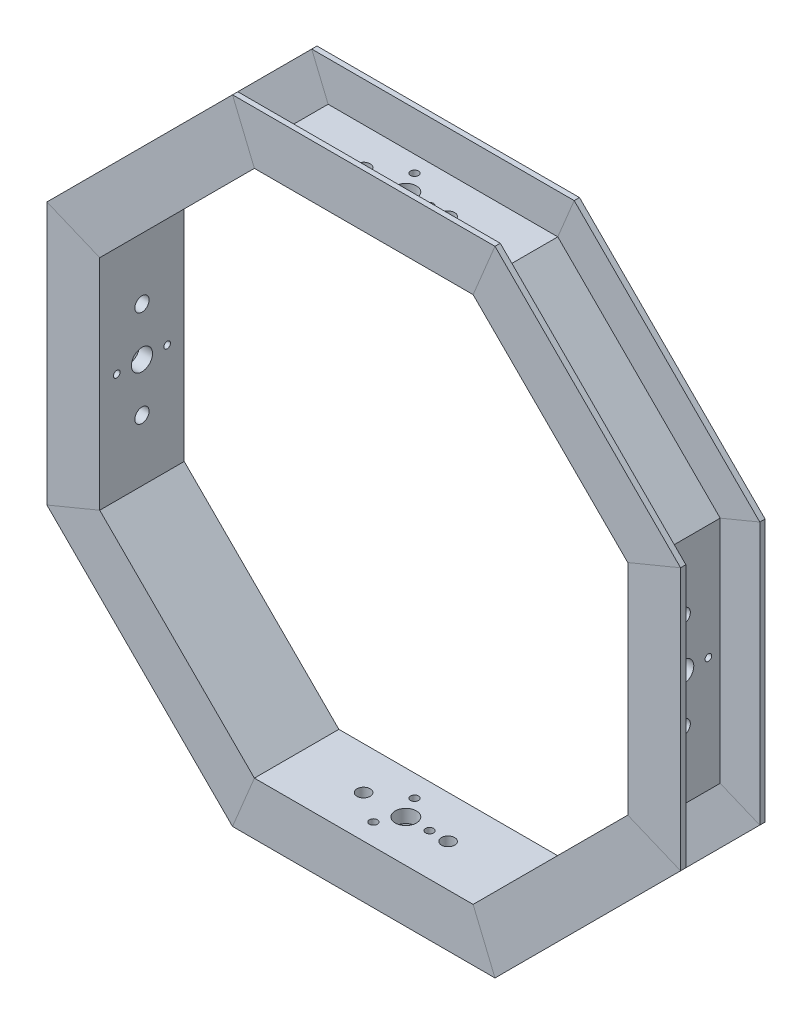
from build123d import *

# Parameters (mm, degrees)
RESSALTO_EXTRUS_O1_DEPTH = 32
CORTE_EXTRUS_O1_REACH    = 238.958
ESBO_O2_R                = 4
ESBO_O2_R_2              = 2.7
ESBO_O2_R_3              = 1.25
ESBO_O4_R                = 4
ESBO_O4_R_2              = 1.5
ESBO_O4_R_3              = 2.5
CORTE_EXTRUS_O8_DEPTH    = 40
RESSALTO_EXTRUS_O2_DEPTH = 2
RESSALTO_EXTRUS_O3_START = 32
RESSALTO_EXTRUS_O3_DEPTH = 2
DIVIDIR1_DEPTH           = 32
DIVIDIR1_2_DEPTH         = 2
DIVIDIR1_START           = 30
DIVIDIR1_3_DEPTH         = 2
DIVIDIR1_4_DEPTH         = 32
DIVIDIR1_5_DEPTH         = 32
DIVIDIR1_6_DEPTH         = 2
DIVIDIR1_7_DEPTH         = 2
DIVIDIR1_8_DEPTH         = 32
DIVIDIR1_9_DEPTH         = 2
DIVIDIR1_10_DEPTH        = 2
DIVIDIR1_START_2         = -105
DIVIDIR1_11_OUTLINE_R    = 2.5
DIVIDIR1_11_OUTLINE_R_2  = 4
DIVIDIR1_11_OUTLINE_R_3  = 1.5
DIVIDIR1_11_DEPTH        = 5
DIVIDIR1_12_DEPTH        = 32
DIVIDIR1_13_DEPTH        = 2
DIVIDIR1_14_DEPTH        = 2
DIVIDIR1_15_DEPTH        = 32
DIVIDIR1_16_DEPTH        = 2
DIVIDIR1_17_DEPTH        = 2
DIVIDIR1_START_3         = 100
DIVIDIR1_18_OUTLINE_R    = 2.7
DIVIDIR1_18_OUTLINE_R_2  = 1.25
DIVIDIR1_18_OUTLINE_R_3  = 4
DIVIDIR1_18_DEPTH        = 5
DIVIDIR1_19_DEPTH        = 32
DIVIDIR1_20_DEPTH        = 2
DIVIDIR1_21_DEPTH        = 2
DIVIDIR1_22_OUTLINE_R    = 4
DIVIDIR1_22_OUTLINE_R_2  = 2.5
DIVIDIR1_22_OUTLINE_R_3  = 1.5
DIVIDIR1_22_DEPTH        = 5
DIVIDIR1_23_DEPTH        = 32
DIVIDIR1_24_DEPTH        = 2
DIVIDIR1_25_DEPTH        = 2


with BuildPart() as part:
    # Esboço1 → Ressalto-extrusão1 (new body)
    with BuildSketch(Plane.XY):
        Polygon((43.492424049, -105), (105, -43.492424049), (105, 43.492424049), (43.492424049, 105), (-43.492424049, 105), (-105, 43.492424049), (-105, -43.492424049), (-43.492424049, -105), align=None)
        Polygon((100, -41.421356237), (100, 41.421356237), (41.421356237, 100), (-41.421356237, 100), (-100, 41.421356237), (-100, -41.421356237), (-41.421356237, -100), (41.421356237, -100), align=None, mode=Mode.SUBTRACT)
    extrude(amount=RESSALTO_EXTRUS_O1_DEPTH)

    # Esboço2 → Corte-extrusão1 (cut, up to next)
    with BuildSketch(Plane(origin=(105, 0, 0), x_dir=(0, 0, -1), z_dir=(1, 0, 0)), mode=Mode.PRIVATE) as corte_extrus_o1_sk1:
        with Locations(Location((-16, 0, 0), (0, 0, 90))):
            Circle(ESBO_O2_R)
    corte_extrus_o1_tool1 = extrude(corte_extrus_o1_sk1.sketch, amount=-CORTE_EXTRUS_O1_REACH, mode=Mode.PRIVATE) & part.part
    # Esboço2 → Corte-extrusão1 (cut, up to next)
    with BuildSketch(Plane(origin=(105, 0, 0), x_dir=(0, 0, -1), z_dir=(1, 0, 0)), mode=Mode.PRIVATE) as corte_extrus_o1_sk2:
        with Locations(Location((-16, 18.25, 0), (0, 0, 90))):
            Circle(ESBO_O2_R_2)
    corte_extrus_o1_tool2 = extrude(corte_extrus_o1_sk2.sketch, amount=-CORTE_EXTRUS_O1_REACH, mode=Mode.PRIVATE) & part.part
    # Esboço2 → Corte-extrusão1 (cut, up to next)
    with BuildSketch(Plane(origin=(105, 0, 0), x_dir=(0, 0, -1), z_dir=(1, 0, 0)), mode=Mode.PRIVATE) as corte_extrus_o1_sk3:
        with Locations(Location((-16, -18.25, 0), (0, 0, 90))):
            Circle(ESBO_O2_R_2)
    corte_extrus_o1_tool3 = extrude(corte_extrus_o1_sk3.sketch, amount=-CORTE_EXTRUS_O1_REACH, mode=Mode.PRIVATE) & part.part
    # Esboço2 → Corte-extrusão1 (cut, up to next)
    with BuildSketch(Plane(origin=(105, 0, 0), x_dir=(0, 0, -1), z_dir=(1, 0, 0)), mode=Mode.PRIVATE) as corte_extrus_o1_sk4:
        with Locations(Location((-6.47, 0, 0), (0, 0, 90))):
            Circle(ESBO_O2_R_3)
    corte_extrus_o1_tool4 = extrude(corte_extrus_o1_sk4.sketch, amount=-CORTE_EXTRUS_O1_REACH, mode=Mode.PRIVATE) & part.part
    # Esboço2 → Corte-extrusão1 (cut, up to next)
    with BuildSketch(Plane(origin=(105, 0, 0), x_dir=(0, 0, -1), z_dir=(1, 0, 0)), mode=Mode.PRIVATE) as corte_extrus_o1_sk5:
        with Locations(Location((-25.53, 0, 0), (0, 0, 90))):
            Circle(ESBO_O2_R_3)
    corte_extrus_o1_tool5 = extrude(corte_extrus_o1_sk5.sketch, amount=-CORTE_EXTRUS_O1_REACH, mode=Mode.PRIVATE) & part.part
    corte_extrus_o1_1 = corte_extrus_o1_tool1.solids().sort_by_distance((105, 0, 16))[0]
    add(corte_extrus_o1_1, mode=Mode.SUBTRACT)
    corte_extrus_o1_2 = corte_extrus_o1_tool2.solids().sort_by_distance((105, 18.25, 16))[0]
    add(corte_extrus_o1_2, mode=Mode.SUBTRACT)
    corte_extrus_o1_3 = corte_extrus_o1_tool3.solids().sort_by_distance((105, -18.25, 16))[0]
    add(corte_extrus_o1_3, mode=Mode.SUBTRACT)
    corte_extrus_o1_4 = corte_extrus_o1_tool4.solids().sort_by_distance((105, 0, 6.47))[0]
    add(corte_extrus_o1_4, mode=Mode.SUBTRACT)
    corte_extrus_o1_5 = corte_extrus_o1_tool5.solids().sort_by_distance((105, 0, 25.53))[0]
    add(corte_extrus_o1_5, mode=Mode.SUBTRACT)
    corte_extrus_o1 = corte_extrus_o1_1 + corte_extrus_o1_2 + corte_extrus_o1_3 + corte_extrus_o1_4 + corte_extrus_o1_5  # Corte-extrusão1 as one shape, for the pattern or mirror that repeats it

    # Esboço4 → Corte-extrusão8 (cut)
    with BuildSketch(Plane(origin=(0, 105, 0), x_dir=(1, 0, 0), z_dir=(0, 1, 0))):
        with Locations(Location((0, -16.056876113, 0), (0, 0, 180))):
            Circle(ESBO_O4_R)
        with Locations(Location((9, -16.056876113, 0), (0, 0, 180))):
            Circle(ESBO_O4_R_2)
        with Locations(Location((-4.5, -23.851104747, 0), (0, 0, 180))):
            Circle(ESBO_O4_R_2)
        with Locations(Location((-4.5, -8.262647479, 0), (0, 0, 180))):
            Circle(ESBO_O4_R_2)
        with Locations(Location((-16, -16.056876113, 0), (0, 0, 180))):
            Circle(ESBO_O4_R_3)
        with Locations(Location((16, -16.056876113, 0), (0, 0, 180))):
            Circle(ESBO_O4_R_3)
    corte_extrus_o8 = extrude(amount=-CORTE_EXTRUS_O8_DEPTH, mode=Mode.SUBTRACT)

    # Espelhar11: Corte-extrusão8 across plane
    add(corte_extrus_o8.mirror(Plane.ZX), mode=Mode.SUBTRACT)

    # Esboço1<3> → Ressalto-extrusão2 (add)
    with BuildSketch(Plane.XY):
        Polygon((49.705627485, -120), (120, -49.705627485), (120, 49.705627485), (49.705627485, 120), (-49.705627485, 120), (-120, 49.705627485), (-120, -49.705627485), (-49.705627485, -120), align=None)
        Polygon((105, -43.492424049), (105, 43.492424049), (43.492424049, 105), (-43.492424049, 105), (-105, 43.492424049), (-105, -43.492424049), (-43.492424049, -105), (43.492424049, -105), align=None, mode=Mode.SUBTRACT)
    extrude(amount=RESSALTO_EXTRUS_O2_DEPTH)

    # Esboço1<4> → Ressalto-extrusão3 (add)
    with BuildSketch(Plane.XY.offset(RESSALTO_EXTRUS_O3_START)):
        Polygon((49.705627485, -120), (120, -49.705627485), (120, 49.705627485), (49.705627485, 120), (-49.705627485, 120), (-120, 49.705627485), (-120, -49.705627485), (-49.705627485, -120), align=None)
        Polygon((105, -43.492424049), (105, 43.492424049), (43.492424049, 105), (-43.492424049, 105), (-105, 43.492424049), (-105, -43.492424049), (-43.492424049, -105), (43.492424049, -105), align=None, mode=Mode.SUBTRACT)
    extrude(amount=-RESSALTO_EXTRUS_O3_DEPTH)

    # Dividir1 4 outline → Dividir1 4 (cut)
    with BuildSketch(Plane.XY):
        Polygon((-41.421356237, -100), (-100, -41.421356237), (-120, -49.705627485), (-49.705627485, -120), (49.705627485, -120), (120, -49.705627485), (120, 49.705627485), (49.705627485, 120), (-49.705627485, 120), (-120, 49.705627485), (-100, 41.421356237), (-41.421356237, 100), (41.421356237, 100), (100, 41.421356237), (100, -41.421356237), (41.421356237, -100), align=None)
    extrude(amount=DIVIDIR1_4_DEPTH, mode=Mode.SUBTRACT)

    # Espelhar12: Corte-extrusão1 across plane
    add(corte_extrus_o1.mirror(Plane.ZY), mode=Mode.SUBTRACT)


with BuildPart() as body_2:
    # Dividir1: read off the stored shape, not the designer's step
    # Dividir1 outline → Dividir1 (new body)
    with BuildSketch(Plane.XY):
        Polygon((105, 43.492424049), (43.492424049, 105), (41.421356237, 100), (100, 41.421356237), align=None)
    extrude(amount=DIVIDIR1_DEPTH)

    # Dividir1 2 outline → Dividir1 2 (add)
    with BuildSketch(Plane.XY):
        Polygon((120, 49.705627485), (49.705627485, 120), (43.492424049, 105), (105, 43.492424049), align=None)
    extrude(amount=DIVIDIR1_2_DEPTH)

    # Dividir1 3 outline → Dividir1 3 (add)
    with BuildSketch(Plane.XY.offset(DIVIDIR1_START)):
        Polygon((120, 49.705627485), (49.705627485, 120), (43.492424049, 105), (105, 43.492424049), align=None)
    extrude(amount=DIVIDIR1_3_DEPTH)


with BuildPart() as body_3:
    # Dividir1 5 outline → Dividir1 5 (new body)
    with BuildSketch(Plane.XY):
        Polygon((-43.492424049, -105), (-41.421356237, -100), (-100, -41.421356237), (-105, -43.492424049), align=None)
    extrude(amount=DIVIDIR1_5_DEPTH)

    # Dividir1 6 outline → Dividir1 6 (add)
    with BuildSketch(Plane.XY):
        Polygon((-49.705627485, -120), (-43.492424049, -105), (-105, -43.492424049), (-120, -49.705627485), align=None)
    extrude(amount=DIVIDIR1_6_DEPTH)

    # Dividir1 7 outline → Dividir1 7 (add)
    with BuildSketch(Plane.XY.offset(DIVIDIR1_START)):
        Polygon((-49.705627485, -120), (-43.492424049, -105), (-105, -43.492424049), (-120, -49.705627485), align=None)
    extrude(amount=DIVIDIR1_7_DEPTH)


with BuildPart() as body_4:
    # Dividir1 8 outline → Dividir1 8 (new body)
    with BuildSketch(Plane.XY):
        Polygon((43.492424049, -105), (41.421356237, -100), (-41.421356237, -100), (-43.492424049, -105), align=None)
    extrude(amount=DIVIDIR1_8_DEPTH)

    # Dividir1 9 outline → Dividir1 9 (add)
    with BuildSketch(Plane.XY):
        Polygon((49.705627485, -120), (43.492424049, -105), (-43.492424049, -105), (-49.705627485, -120), align=None)
    extrude(amount=DIVIDIR1_9_DEPTH)

    # Dividir1 10 outline → Dividir1 10 (add)
    with BuildSketch(Plane.XY.offset(DIVIDIR1_START)):
        Polygon((49.705627485, -120), (43.492424049, -105), (-43.492424049, -105), (-49.705627485, -120), align=None)
    extrude(amount=DIVIDIR1_10_DEPTH)

    # Dividir1 11 outline → Dividir1 11 (cut)
    with BuildSketch(Plane(origin=(0, 0, 0), x_dir=(1, 0, 0), z_dir=(0, 1, 0)).offset(DIVIDIR1_START_2)):
        with Locations((16, -16.056876113)):
            Circle(DIVIDIR1_11_OUTLINE_R)
        with Locations((0, -16.056876113)):
            Circle(DIVIDIR1_11_OUTLINE_R_2)
        with Locations((-16, -16.056876113)):
            Circle(DIVIDIR1_11_OUTLINE_R)
        with Locations((-4.5, -23.851104747)):
            Circle(DIVIDIR1_11_OUTLINE_R_3)
        with Locations((9, -16.056876113)):
            Circle(DIVIDIR1_11_OUTLINE_R_3)
        with Locations((-4.5, -8.262647479)):
            Circle(DIVIDIR1_11_OUTLINE_R_3)
    extrude(amount=DIVIDIR1_11_DEPTH, mode=Mode.SUBTRACT)


with BuildPart() as body_5:
    # Dividir1 12 outline → Dividir1 12 (new body)
    with BuildSketch(Plane.XY):
        Polygon((105, -43.492424049), (100, -41.421356237), (41.421356237, -100), (43.492424049, -105), align=None)
    extrude(amount=DIVIDIR1_12_DEPTH)

    # Dividir1 13 outline → Dividir1 13 (add)
    with BuildSketch(Plane.XY):
        Polygon((120, -49.705627485), (105, -43.492424049), (43.492424049, -105), (49.705627485, -120), align=None)
    extrude(amount=DIVIDIR1_13_DEPTH)

    # Dividir1 14 outline → Dividir1 14 (add)
    with BuildSketch(Plane.XY.offset(DIVIDIR1_START)):
        Polygon((120, -49.705627485), (105, -43.492424049), (43.492424049, -105), (49.705627485, -120), align=None)
    extrude(amount=DIVIDIR1_14_DEPTH)


with BuildPart() as body_6:
    # Dividir1 15 outline → Dividir1 15 (new body)
    with BuildSketch(Plane.XY):
        Polygon((105, 43.492424049), (100, 41.421356237), (100, -41.421356237), (105, -43.492424049), align=None)
    extrude(amount=DIVIDIR1_15_DEPTH)

    # Dividir1 16 outline → Dividir1 16 (add)
    with BuildSketch(Plane.XY):
        Polygon((120, 49.705627485), (105, 43.492424049), (105, -43.492424049), (120, -49.705627485), align=None)
    extrude(amount=DIVIDIR1_16_DEPTH)

    # Dividir1 17 outline → Dividir1 17 (add)
    with BuildSketch(Plane.XY.offset(DIVIDIR1_START)):
        Polygon((120, 49.705627485), (105, 43.492424049), (105, -43.492424049), (120, -49.705627485), align=None)
    extrude(amount=DIVIDIR1_17_DEPTH)

    # Dividir1 18 outline → Dividir1 18 (cut)
    with BuildSketch(Plane.YZ.offset(DIVIDIR1_START_3)):
        with Locations((-18.25, 16)):
            Circle(DIVIDIR1_18_OUTLINE_R)
        with Locations((0, 25.53)):
            Circle(DIVIDIR1_18_OUTLINE_R_2)
        with Locations((0, 6.47)):
            Circle(DIVIDIR1_18_OUTLINE_R_2)
        with Locations((0, 16)):
            Circle(DIVIDIR1_18_OUTLINE_R_3)
        with Locations((18.25, 16)):
            Circle(DIVIDIR1_18_OUTLINE_R)
    extrude(amount=DIVIDIR1_18_DEPTH, mode=Mode.SUBTRACT)


with BuildPart() as body_7:
    # Dividir1 19 outline → Dividir1 19 (new body)
    with BuildSketch(Plane.XY):
        Polygon((41.421356237, 100), (43.492424049, 105), (-43.492424049, 105), (-41.421356237, 100), align=None)
    extrude(amount=DIVIDIR1_19_DEPTH)

    # Dividir1 20 outline → Dividir1 20 (add)
    with BuildSketch(Plane.XY):
        Polygon((43.492424049, 105), (49.705627485, 120), (-49.705627485, 120), (-43.492424049, 105), align=None)
    extrude(amount=DIVIDIR1_20_DEPTH)

    # Dividir1 21 outline → Dividir1 21 (add)
    with BuildSketch(Plane.XY.offset(DIVIDIR1_START)):
        Polygon((43.492424049, 105), (49.705627485, 120), (-49.705627485, 120), (-43.492424049, 105), align=None)
    extrude(amount=DIVIDIR1_21_DEPTH)

    # Dividir1 22 outline → Dividir1 22 (cut)
    with BuildSketch(Plane(origin=(0, 0, 0), x_dir=(1, 0, 0), z_dir=(0, 1, 0)).offset(DIVIDIR1_START_3)):
        with Locations((0, -16.056876113)):
            Circle(DIVIDIR1_22_OUTLINE_R)
        with Locations((-16, -16.056876113)):
            Circle(DIVIDIR1_22_OUTLINE_R_2)
        with Locations((-4.5, -23.851104747)):
            Circle(DIVIDIR1_22_OUTLINE_R_3)
        with Locations((9, -16.056876113)):
            Circle(DIVIDIR1_22_OUTLINE_R_3)
        with Locations((-4.5, -8.262647479)):
            Circle(DIVIDIR1_22_OUTLINE_R_3)
        with Locations((16, -16.056876113)):
            Circle(DIVIDIR1_22_OUTLINE_R_2)
    extrude(amount=DIVIDIR1_22_DEPTH, mode=Mode.SUBTRACT)


with BuildPart() as body_8:
    # Dividir1 23 outline → Dividir1 23 (new body)
    with BuildSketch(Plane.XY):
        Polygon((-41.421356237, 100), (-43.492424049, 105), (-105, 43.492424049), (-100, 41.421356237), align=None)
    extrude(amount=DIVIDIR1_23_DEPTH)

    # Dividir1 24 outline → Dividir1 24 (add)
    with BuildSketch(Plane.XY):
        Polygon((-43.492424049, 105), (-49.705627485, 120), (-120, 49.705627485), (-105, 43.492424049), align=None)
    extrude(amount=DIVIDIR1_24_DEPTH)

    # Dividir1 25 outline → Dividir1 25 (add)
    with BuildSketch(Plane.XY.offset(DIVIDIR1_START)):
        Polygon((-43.492424049, 105), (-49.705627485, 120), (-120, 49.705627485), (-105, 43.492424049), align=None)
    extrude(amount=DIVIDIR1_25_DEPTH)


solid = Compound([part.part, body_2.part, body_3.part, body_4.part, body_5.part, body_6.part, body_7.part, body_8.part])
